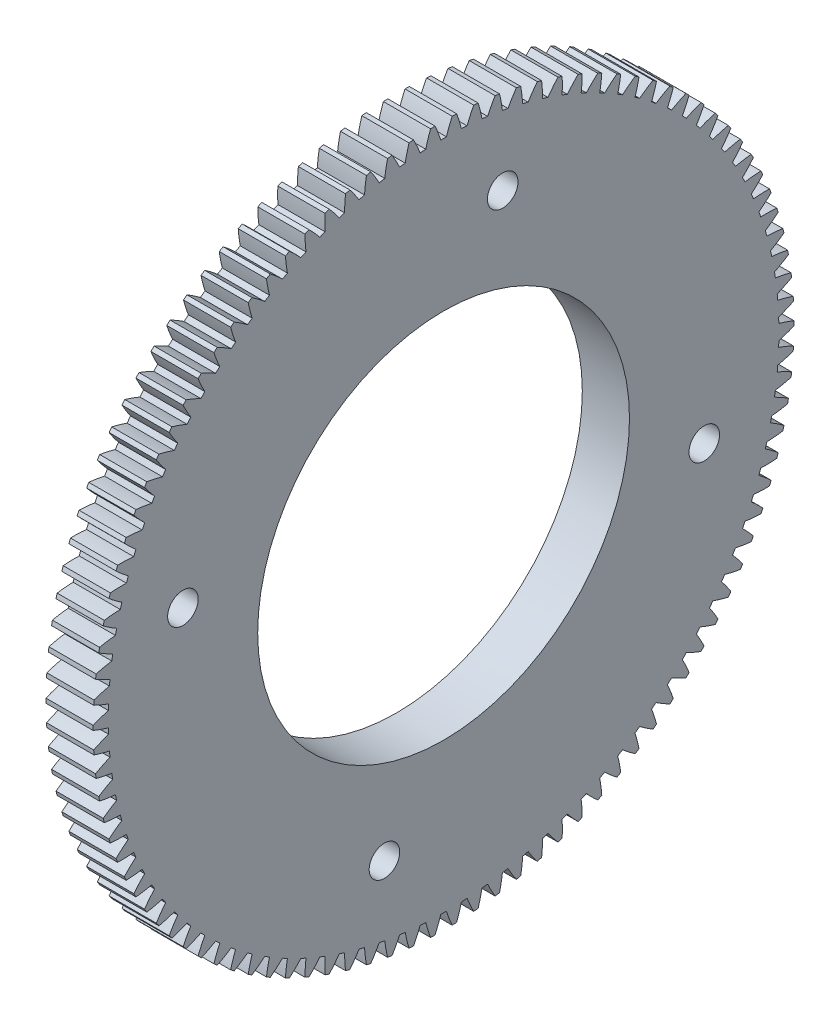
from build123d import *

# Parameters (mm, degrees)
BASPROSKE_W        = 8.89
BASPROSKE_H        = 66.04
TOOTHCUT_DEPTH     = 94.816817789
TEETHCUTS_COUNT    = 102
TEETHCUTS_ANGLE    = 356.470588235
BORSKE_R           = 0.396875
BORE_DEPTH         = 50.8000508
SKETCH1_R          = 35.034795594
CUT_EXTRUDE1_DEPTH = 94.802936166
SKETCH2_R          = 2.879593525
CUT_EXTRUDE2_DEPTH = 94.802936166


with BuildPart() as part:
    # BasProSke → Base-Revolve (revolve)
    with BuildSketch(Plane(origin=(0, 0, 0), x_dir=(1, 0, 0), z_dir=(0, 1, 0))):
        with Locations((4.445, 33.02)):
            Rectangle(BASPROSKE_W, BASPROSKE_H)
    revolve(axis=Axis((-10, 0, 0), (1, 0, 0)))

    # TooCutSke → ToothCut (cut, through all)
    with BuildSketch(Plane(origin=(0, 0, 0), x_dir=(0, 0, -1), z_dir=(1, 0, 0))):
        with BuildLine():
            ThreePointArc((0.534790556, 63.192937122), (0, 63.1952), (-0.534790556, 63.192937122))
            ThreePointArc((-0.534790556, 63.192937122), (-1.037913992, 64.635251799), (-1.625165547, 66.045407971))
            ThreePointArc((-1.625165547, 66.045407971), (0, 66.0654), (1.625165547, 66.045407971))
            ThreePointArc((1.625165547, 66.045407971), (1.037913992, 64.635251799), (0.534790556, 63.192937122))
        make_face()
    toothcut = extrude(amount=TOOTHCUT_DEPTH, mode=Mode.SUBTRACT)

    # TeethCuts: ToothCut ×102 about axis
    teethcuts_axis = Axis((-10, 0, 0), (1, 0, 0))
    for i in range(1, TEETHCUTS_COUNT):
        add(toothcut.rotate(teethcuts_axis, i * TEETHCUTS_ANGLE / (TEETHCUTS_COUNT - 1)), mode=Mode.SUBTRACT)

    # BorSke → Bore (cut, symmetric)
    with BuildSketch(Plane(origin=(0, 0, 0), x_dir=(0, 0, -1), z_dir=(1, 0, 0))):
        Circle(BORSKE_R)
    extrude(amount=BORE_DEPTH, both=True, mode=Mode.SUBTRACT)

    # Sketch1 → Cut-Extrude1 (cut, through all)
    with BuildSketch(Plane(origin=(8.89, 0, 0), x_dir=(0, 0, -1), z_dir=(1, 0, 0))):
        Circle(SKETCH1_R)
    extrude(amount=-CUT_EXTRUDE1_DEPTH, mode=Mode.SUBTRACT)

    # Sketch2 → Cut-Extrude2 (cut, through all)
    with BuildSketch(Plane(origin=(8.89, 0, 0), x_dir=(0, 0, -1), z_dir=(1, 0, 0))):
        with Locations((11.143530836, 49.127002203)):
            Circle(SKETCH2_R)
        with Locations((49.127002203, -11.143530836)):
            Circle(SKETCH2_R)
        with Locations((-11.143530836, -49.127002203)):
            Circle(SKETCH2_R)
        with Locations((-49.127002203, 11.143530836)):
            Circle(SKETCH2_R)
    extrude(amount=-CUT_EXTRUDE2_DEPTH, mode=Mode.SUBTRACT)


solid = part.part
